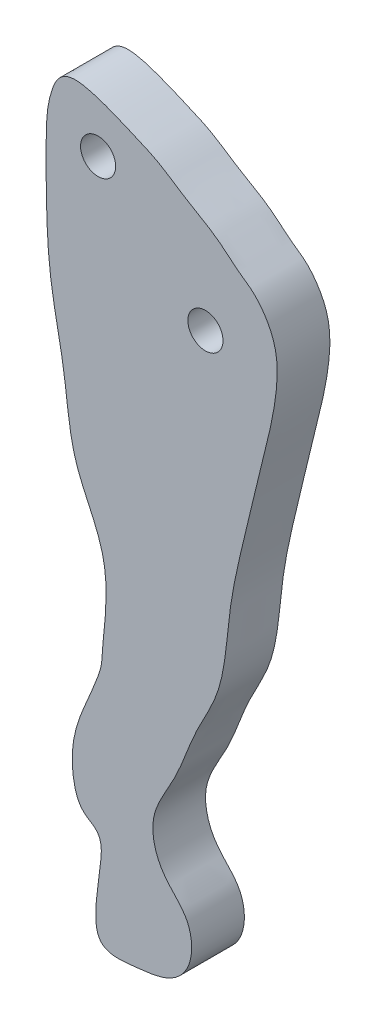
from build123d import *

# Parameters (mm, degrees)
SKETCH1_R           = 1
BOSS_EXTRUDE1_DEPTH = 3


with BuildPart() as part:
    # Sketch1 → Boss-Extrude1 (new body)
    with BuildSketch(Plane.XY):
        with BuildLine():
            add(Edge.make_bspline(
                [(-15.468204456, 11.712747055), (-15.272446323, 12.256811839), (-14.694261771, 13.375456495), (-10.747210876, 11.685620072), (-9.378859991, 11.101105577), (-7.935606405, 10.0666802), (-6.0861698, 9.076651678), (-5.224146094, 8.240554648), (-4.468119126, 7.688143182), (-3.819649337, 7.264924706), (-2.650882753, 5.657730413), (-2.629864215, 3.30204689), (-3.102059643, 0.907695055), (-3.699438781, -1.346847144), (-4.470747658, -4.729915828), (-5.527828981, -8.847764056), (-5.631350788, -13.044529764), (-7.507808601, -16.094030577), (-8.348893228, -18.859439282), (-10.099175378, -21.277304553), (-9.407739302, -23.948432017), (-7.568034127, -25.277618233), (-7.421300252, -27.700715999), (-8.693877337, -29.04436701), (-11.019423571, -29.275771778), (-13.274059344, -29.54175631), (-12.746965546, -24.986134625), (-12.448721016, -23.677448978), (-14.126669743, -22.990564433), (-14.567295733, -19.967840926), (-12.467343692, -15.142880915), (-12.844575476, -15.732097737), (-12.03447618, -9.801403815), (-14.453523921, -6.348190438), (-14.683080959, -1.98597908), (-15.708635077, 2.219227766), (-15.837753695, 5.990247985), (-15.844145609, 9.526404854), (-15.75446731, 10.917145179), (-15.468204456, 11.712747055)],
                knots=[0, 0, 0, 0, 0.019167673, 0.035852014, 0.04922113, 0.065362599, 0.08061576, 0.09473419, 0.096820482, 0.101478682, 0.125428179, 0.150735164, 0.177782922, 0.196742022, 0.232864058, 0.285139057, 0.334734415, 0.362743594, 0.397641911, 0.42772934, 0.45292082, 0.47629891, 0.496976086, 0.520565297, 0.535628386, 0.556474129, 0.575336841, 0.609704642, 0.622665552, 0.634741166, 0.653971369, 0.715131704, 0.757143736, 0.804519559, 0.849469401, 0.89291477, 0.942684833, 0.97197055, 1, 1, 1, 1], degree=3))
        make_face()
        with Locations((-6.761595865, 4.121832487)):
            Circle(SKETCH1_R, mode=Mode.SUBTRACT)
        with Locations((-12.874737023, 9.662343215)):
            Circle(SKETCH1_R, mode=Mode.SUBTRACT)
    extrude(amount=BOSS_EXTRUDE1_DEPTH)


solid = part.part
